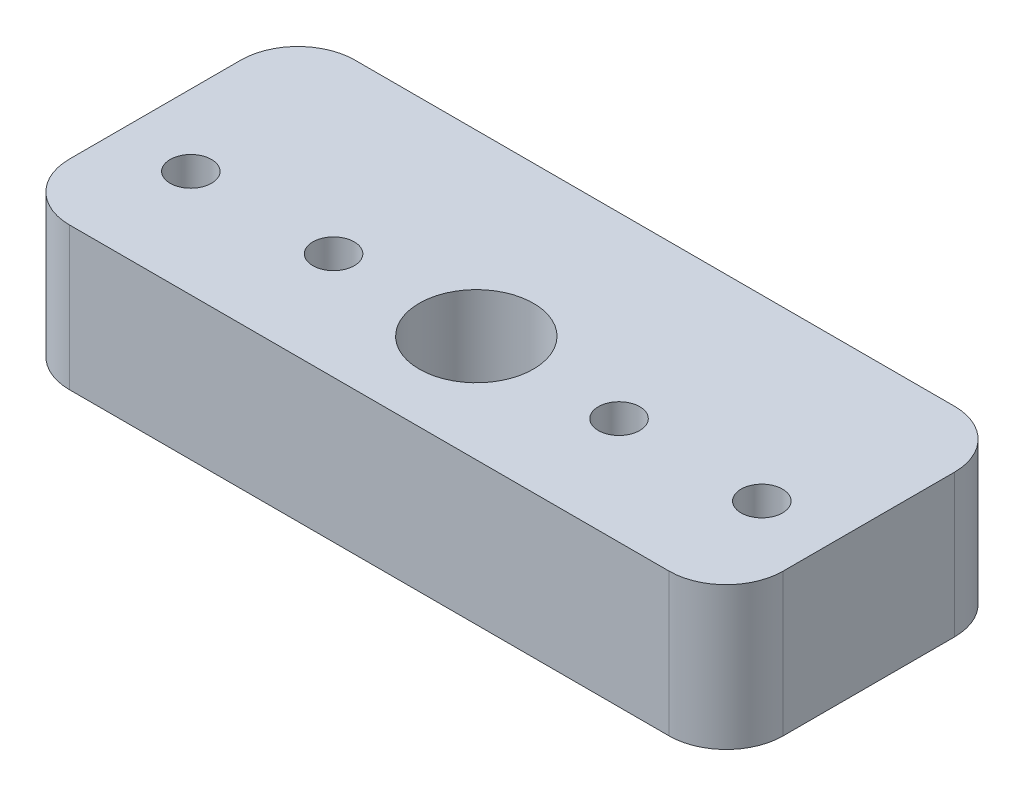
from build123d import *

# Parameters (mm, degrees)
SKETCH1_R           = 4
SKETCH1_R_2         = 1.45
BOSS_EXTRUDE1_DEPTH = 10


with BuildPart() as part:
    # Sketch1 → Boss-Extrude1 (new body)
    with BuildSketch(Plane(origin=(0, 0, 0), x_dir=(1, 0, 0), z_dir=(0, 1, 0))):
        with BuildLine():
            Line((-21, 10), (21, 10))
            ThreePointArc((21, 10), (23.828427125, 8.828427125), (25, 6))
            Line((25, 6), (25, -6))
            ThreePointArc((25, -6), (23.828427125, -8.828427125), (21, -10))
            Line((21, -10), (-21, -10))
            ThreePointArc((-21, -10), (-23.828427125, -8.828427125), (-25, -6))
            Line((-25, -6), (-25, 6))
            ThreePointArc((-25, 6), (-23.828427125, 8.828427125), (-21, 10))
        make_face()
        with Locations((0, -2.5)):
            Circle(SKETCH1_R, mode=Mode.SUBTRACT)
        with Locations((10, -2.5)):
            Circle(SKETCH1_R_2, mode=Mode.SUBTRACT)
        with Locations((20, -2.5)):
            Circle(SKETCH1_R_2, mode=Mode.SUBTRACT)
        with Locations((-20, -2.5)):
            Circle(SKETCH1_R_2, mode=Mode.SUBTRACT)
        with Locations((-10, -2.5)):
            Circle(SKETCH1_R_2, mode=Mode.SUBTRACT)
    extrude(amount=BOSS_EXTRUDE1_DEPTH)


solid = part.part
